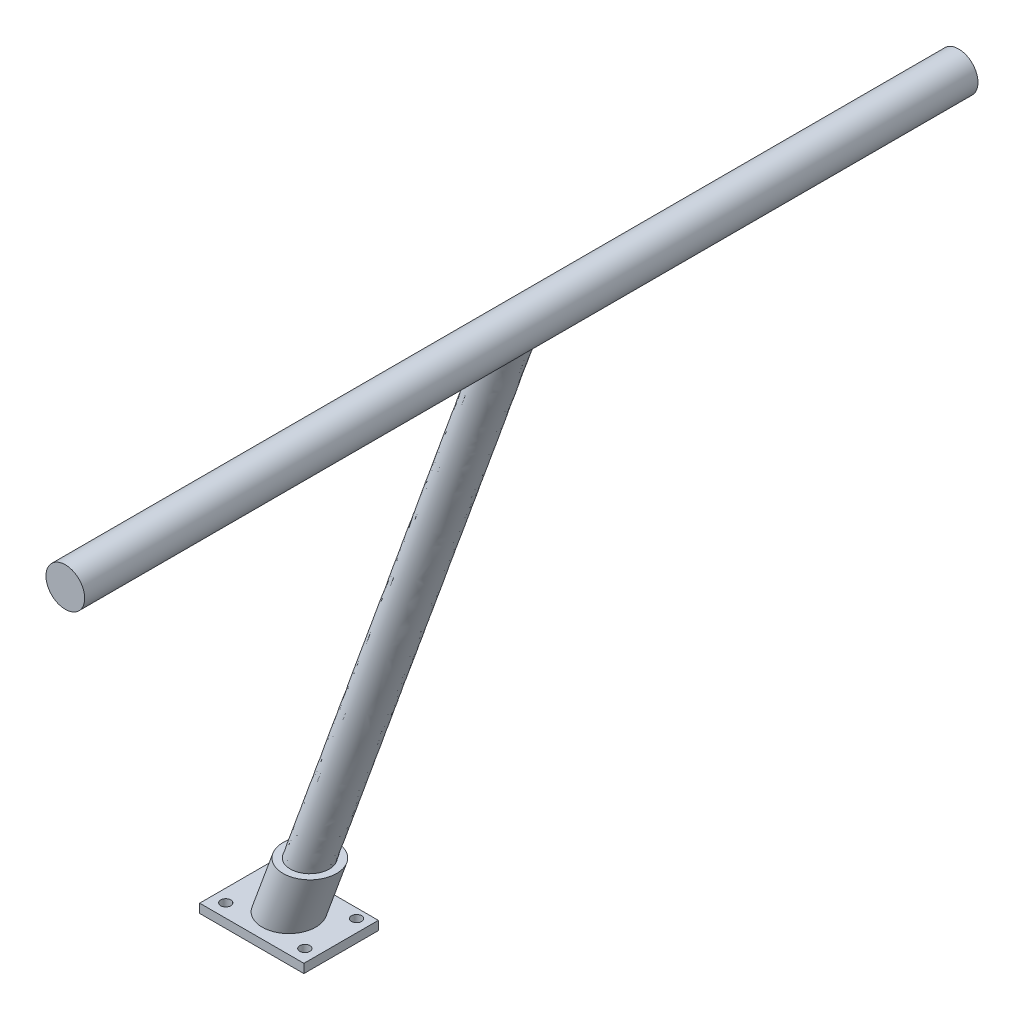
from build123d import *

# Parameters (mm, degrees)
IZIM1_W                     = 35
IZIM1_H                     = 25
Y_KSEKLIK_EKSTR_ZYON1_DEPTH = 3
IZIM2_R                     = 9
IZIM2_R_2                   = 6.5
IZIM9_R                     = 6.5
IZIM13_R                    = 6.5
Y_KSEKLIK_EKSTR_ZYON3_DEPTH = 150
M3_BO_LUKLU_DELIK1_D        = 3.4
M3_BO_LUKLU_DELIK1_DEPTH    = 3


with BuildPart() as part:
    # Çizim1 → Yükseklik-Ekstrüzyon1 (new body)
    with BuildSketch(Plane(origin=(0, 0, 0), x_dir=(1, 0, 0), z_dir=(0, 1, 0))):
        Rectangle(IZIM1_W, IZIM1_H)
    extrude(amount=Y_KSEKLIK_EKSTR_ZYON1_DEPTH)

    # Süpür1: sweep along a path in Çizim5
    with BuildLine(Plane.XY) as s_p_r1_path:
        Line((0, 3), (7.004599808, 22.138442505))
    # Çizim2 → Süpür1 (sweep)
    with BuildSketch(Plane(origin=(0, 3, 0), x_dir=(1, 0, 0), z_dir=(0, 1, 0))):
        Circle(IZIM2_R)
        Circle(IZIM2_R_2, mode=Mode.SUBTRACT)
    sweep(path=s_p_r1_path.line)

    # Süpür2: sweep along a path in Çizim11
    with BuildLine(Plane.XY) as s_p_r2_path:
        Line((0, 3), (74.882319817, 209.863815538))
    # Çizim9 → Süpür2 (sweep)
    with BuildSketch(Plane(origin=(0, 3, 0), x_dir=(1, 0, 0), z_dir=(0, 1, 0))):
        Circle(IZIM9_R)
    sweep(path=s_p_r2_path.line)

    # Çizim13 → Yükseklik-Ekstrüzyon3 (add, symmetric)
    with BuildSketch(Plane.XY):
        with Locations((74.882319817, 209.863815538)):
            Circle(IZIM13_R)
    extrude(amount=Y_KSEKLIK_EKSTR_ZYON3_DEPTH, both=True)

    # M3 Boşluklu Delik1
    with Locations(Plane(origin=(0, 3, 0), x_dir=(1, 0, 0), z_dir=(0, 1, 0))):
        with Locations((-13.209013164, -8.030166901), (-13.209013164, 9.355779361), (13.345161769, -8.030166901), (13.345161769, 9.355779361)):
            Hole(M3_BO_LUKLU_DELIK1_D / 2, depth=M3_BO_LUKLU_DELIK1_DEPTH)


solid = part.part
